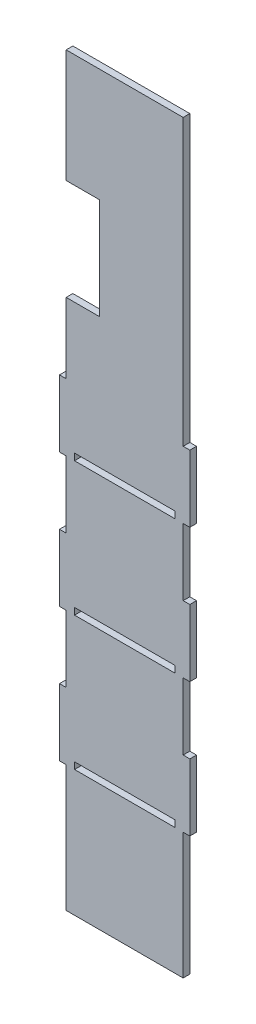
from build123d import *

# Parameters (mm, degrees)
SKETCH_1_W      = 30
SKETCH_1_H      = 2
EXTRUDE_2_DEPTH = 2


with BuildPart() as part:
    # 草图1 → 凸台-拉伸2 (new body)
    with BuildSketch(Plane.XY):
        Polygon((-8, 15.14100393), (-8, 49), (27, 49), (27, -36.22154055), (29, -36.22154055), (29, -56.22154055), (27, -56.22154055), (27, -76.22154055), (29, -76.22154055), (29, -96.22154055), (27, -96.22154055), (27, -116.22154055), (29, -116.22154055), (29, -136.22154055), (27, -136.22154055), (27, -174), (-8, -174), (-8, -136.22154055), (-10, -136.22154055), (-10, -116.22154055), (-8, -116.22154055), (-8, -96.22154055), (-10, -96.22154055), (-10, -76.22154055), (-8, -76.22154055), (-8, -56.22154055), (-10, -56.22154055), (-10, -36.22154055), (-8, -36.22154055), (-8, -15.14100393), (2, -15.14100393), (2, 15.14100393), align=None)
        with Locations((9.5, -95.22154055)):
            Rectangle(SKETCH_1_W, SKETCH_1_H, mode=Mode.SUBTRACT)
        with Locations((9.5, -135.22154055)):
            Rectangle(SKETCH_1_W, SKETCH_1_H, mode=Mode.SUBTRACT)
        with Locations((9.5, -55.22154055)):
            Rectangle(SKETCH_1_W, SKETCH_1_H, mode=Mode.SUBTRACT)
    extrude(amount=EXTRUDE_2_DEPTH)


solid = part.part
